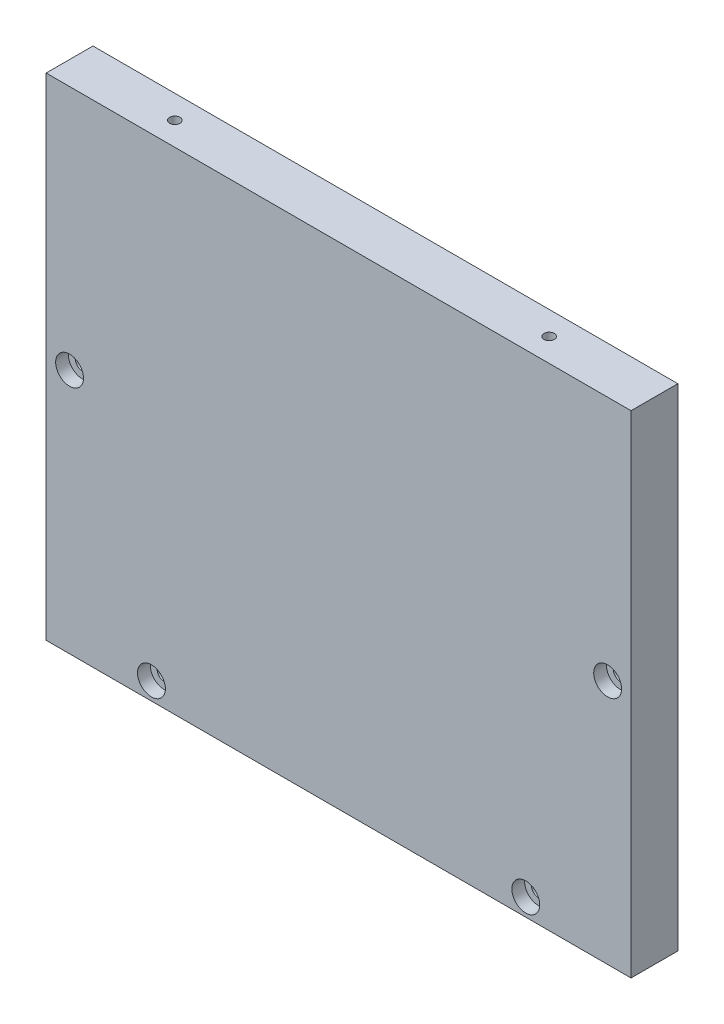
from build123d import *

# Parameters (mm, degrees)
SKETCH1_W                                      = 100
SKETCH1_H                                      = 84
BOSS_EXTRUDE1_DEPTH                            = 8
CBORE_FOR_2_SOCKET_HEAD_CAP_SCREW1_D           = 2.4384
CBORE_FOR_2_SOCKET_HEAD_CAP_SCREW1_DEPTH       = 12.27
CBORE_FOR_2_SOCKET_HEAD_CAP_SCREW1_CBORE_D     = 4.7625
CBORE_FOR_2_SOCKET_HEAD_CAP_SCREW1_CBORE_DEPTH = 2.1844
CBORE_FOR_2_SOCKET_HEAD_CAP_SCREW1_TIP         = 0.732569267
CBORE_FOR_2_SOCKET_HEAD_CAP_SCREW2_D           = 2.4384
CBORE_FOR_2_SOCKET_HEAD_CAP_SCREW2_DEPTH       = 12.27
CBORE_FOR_2_SOCKET_HEAD_CAP_SCREW2_CBORE_D     = 4.7625
CBORE_FOR_2_SOCKET_HEAD_CAP_SCREW2_CBORE_DEPTH = 2.1844
CBORE_FOR_2_SOCKET_HEAD_CAP_SCREW2_TIP         = 0.732569267
F_2_56_TAPPED_HOLE1_D                          = 1.778
F_2_56_TAPPED_HOLE1_DEPTH                      = 12
F_2_56_TAPPED_HOLE1_TIP                        = 0.53416509


with BuildPart() as part:
    # Sketch1 → Boss-Extrude1 (new body)
    with BuildSketch(Plane.XY):
        Rectangle(SKETCH1_W, SKETCH1_H)
    extrude(amount=BOSS_EXTRUDE1_DEPTH)

    # CBORE for #2 Socket Head Cap Screw1
    with Locations(Plane(origin=(-32, -39, 8), x_dir=(1, 0, 0), z_dir=(0, 0, 1))):
        with Locations((0, 0), (64, 0)):
            CounterBoreHole(CBORE_FOR_2_SOCKET_HEAD_CAP_SCREW1_D / 2, CBORE_FOR_2_SOCKET_HEAD_CAP_SCREW1_CBORE_D / 2, CBORE_FOR_2_SOCKET_HEAD_CAP_SCREW1_CBORE_DEPTH, depth=CBORE_FOR_2_SOCKET_HEAD_CAP_SCREW1_DEPTH)
            with Locations((0, 0, -(CBORE_FOR_2_SOCKET_HEAD_CAP_SCREW1_DEPTH + CBORE_FOR_2_SOCKET_HEAD_CAP_SCREW1_TIP / 2))):  # 118° drill point
                Cone(0, CBORE_FOR_2_SOCKET_HEAD_CAP_SCREW1_D / 2, CBORE_FOR_2_SOCKET_HEAD_CAP_SCREW1_TIP, mode=Mode.SUBTRACT)

    # CBORE for #2 Socket Head Cap Screw2
    with Locations(Plane(origin=(-46, 0, 8), x_dir=(1, 0, 0), z_dir=(0, 0, 1))):
        with Locations((0, 0), (92, 0)):
            CounterBoreHole(CBORE_FOR_2_SOCKET_HEAD_CAP_SCREW2_D / 2, CBORE_FOR_2_SOCKET_HEAD_CAP_SCREW2_CBORE_D / 2, CBORE_FOR_2_SOCKET_HEAD_CAP_SCREW2_CBORE_DEPTH, depth=CBORE_FOR_2_SOCKET_HEAD_CAP_SCREW2_DEPTH)
            with Locations((0, 0, -(CBORE_FOR_2_SOCKET_HEAD_CAP_SCREW2_DEPTH + CBORE_FOR_2_SOCKET_HEAD_CAP_SCREW2_TIP / 2))):  # 118° drill point
                Cone(0, CBORE_FOR_2_SOCKET_HEAD_CAP_SCREW2_D / 2, CBORE_FOR_2_SOCKET_HEAD_CAP_SCREW2_TIP, mode=Mode.SUBTRACT)

    # #2-56 Tapped Hole1
    with Locations(Plane(origin=(-32, 42, 4), x_dir=(0, 0, 1), z_dir=(0, 1, 0))):
        with Locations((0, 0), (0, 64)):
            Hole(F_2_56_TAPPED_HOLE1_D / 2, depth=F_2_56_TAPPED_HOLE1_DEPTH)
            with Locations((0, 0, -(F_2_56_TAPPED_HOLE1_DEPTH + F_2_56_TAPPED_HOLE1_TIP / 2))):  # 118° drill point
                Cone(0, F_2_56_TAPPED_HOLE1_D / 2, F_2_56_TAPPED_HOLE1_TIP, mode=Mode.SUBTRACT)


solid = part.part
